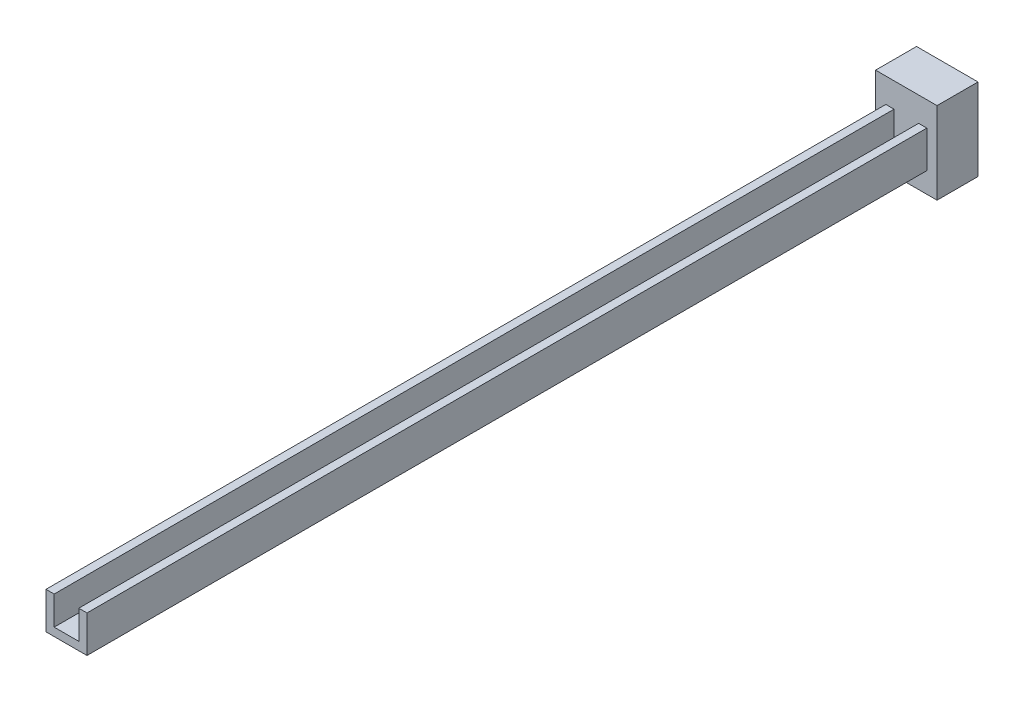
from build123d import *

# Parameters (mm, degrees)
EXTRUDE_1_DEPTH          = 245
SKETCH_2_R               = 2.5
CUT_EXTRUDE_1_DEPTH      = 246.21623111
CUT_EXTRUDE_2_DEPTH      = 246.21623111
CUT_EXTRUDE_2_DEPTH_BACK = 246.21623111
SKETCH_3_W               = 10
SKETCH_3_H               = 40
SKETCH_5_W               = 15
SKETCH_5_H               = 20
EXTRUDE_3_DEPTH          = 10


with BuildPart() as part:
    # ｽｹｯﾁ1 → ﾎﾞｽ - 押し出し1 (new body)
    with BuildSketch(Plane.XY):
        Polygon((-5, 9), (-5, 0), (5, 0), (5, 9), (3, 9), (3, 2), (-3, 2), (-3, 9), align=None)
    extrude(amount=EXTRUDE_1_DEPTH)

    # ｽｹｯﾁ2 → ｶｯﾄ - 押し出し1 (cut, through all)
    with BuildSketch(Plane.XZ):
        with Locations((0, 225)):
            Circle(SKETCH_2_R)
        with Locations((0, 217)):
            Circle(SKETCH_2_R)
        with Locations((0, 122.5)):
            Circle(SKETCH_2_R)
        with Locations((0, 209)):
            Circle(SKETCH_2_R)
        with Locations((0, 193)):
            Circle(SKETCH_2_R)
        with Locations((0, 161)):
            Circle(SKETCH_2_R)
    cut_extrude_1 = extrude(amount=-CUT_EXTRUDE_1_DEPTH, mode=Mode.SUBTRACT)

    # ﾐﾗｰ1: ｶｯﾄ - 押し出し1 across plane
    add(cut_extrude_1.mirror(Plane.XY.offset(122.5)), mode=Mode.SUBTRACT)

    # ｽｹｯﾁ3 → ｶｯﾄ - 押し出し2 (cut, two sides: drawn at the far end of the back side and taken through both)
    with BuildSketch(Plane.XZ.offset(-CUT_EXTRUDE_2_DEPTH_BACK)):
        with Locations((0, 20)):
            Rectangle(SKETCH_3_W, SKETCH_3_H)
    extrude(amount=CUT_EXTRUDE_2_DEPTH + CUT_EXTRUDE_2_DEPTH_BACK, mode=Mode.SUBTRACT)

    # ｽｹｯﾁ5 → ﾎﾞｽ - 押し出し3 (add)
    with BuildSketch(Plane(origin=(0, 0, 40), x_dir=(-1, 0, 0), z_dir=(0, 0, -1))):
        with Locations((0, 5)):
            Rectangle(SKETCH_5_W, SKETCH_5_H)
    extrude(amount=EXTRUDE_3_DEPTH)


solid = part.part
